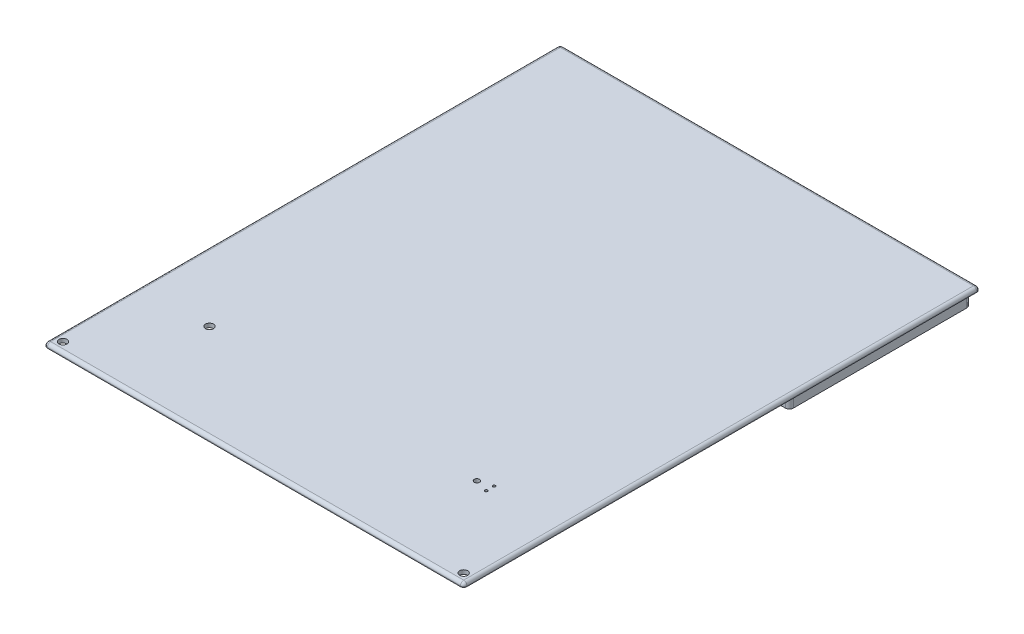
from build123d import *

# Parameters (mm, degrees)
BOSS_EXTRUDE1_DEPTH      = 1.25
SKETCH1_W                = 156
SKETCH1_H                = 69.5
BOSS_EXTRUDE2_DEPTH      = 105
SKETCH4_R                = 2.5000000000000027
BOSS_EXTRUDE3_DEPTH      = 8
FILLET2_R                = 2
SKETCH5_R                = 1.5499999999999998
SKETCH5_R_2              = 1.5500000000000012
CUT_EXTRUDE1_DEPTH       = 8
SKETCH6_R                = 8.25
CUT_EXTRUDE2_DEPTH       = 8
SKETCH8_R                = 3.750000000000007
SKETCH8_R_2              = 3.0000000000000084
SKETCH8_W                = 7.000000000000014
SKETCH8_H                = 14
CUT_EXTRUDE3_DEPTH       = 8
FILLET3_R                = 1.25
FILLET4_R                = 1.25
SKETCH11_R               = 1.5499999999999932
CUT_EXTRUDE4_DEPTH       = 8
BOSS_EXTRUDE5_REACH      = 209.004
FILLET5_R                = 1.25
SKETCH14_R               = 1.5249999999999995
CUT_EXTRUDE5_DEPTH       = 8
BOSS_EXTRUDE6_DEPTH      = 5
CUT_EXTRUDE10_DEPTH      = 176.50000000000017
CUT_EXTRUDE10_DEPTH_BACK = 9
SKETCH19_R               = 1.5249999999999995
BOSS_EXTRUDE7_DEPTH      = 1.5
SKETCH17_W               = 214.39373035957487
SKETCH17_H               = 311.75060194691184
CUT_EXTRUDE6_DEPTH       = 142.50000000000003
SKETCH18_W               = 843.8612520819788
SKETCH18_H               = 210.19069540658822
CUT_EXTRUDE7_DEPTH       = 211.50000000000009
FILLET6_R                = 1.25
SKETCH21_R               = 1.5249999999999995
CUT_EXTRUDE11_DEPTH      = 46.50000000000004
SKETCH22_R               = 1.5249999999999952
SKETCH22_R_2             = 0.49999999999999917
SKETCH22_R_3             = 0.9999999999999983
CUT_EXTRUDE12_DEPTH      = 46.50000000000004


with BuildPart() as part:
    # Sketch2 → Boss-Extrude1 (new body)
    with BuildSketch(Plane(origin=(0, 0, 0), x_dir=(1, 0, 0), z_dir=(0, 1, 0))):
        Polygon((-79.25000000000004, 35.99999999999998), (79.24999999999996, 35.99999999999999), (79.24999999999999, -159.00000000000003), (-79.25000000000001, -159.00000000000003), align=None)
    extrude(amount=-BOSS_EXTRUDE1_DEPTH)

    # Sketch1 → Boss-Extrude2 (add)
    with BuildSketch(Plane(origin=(0, 0, 0), x_dir=(1, 0, 0), z_dir=(0, 1, 0))):
        Polygon((79.24999999999999, -159.00000000000003), (-79.25000000000001, -159.00000000000003), (-79.25000000000004, -86.00000000000001), (-79.25000000000004, -36.00000000000002), (-79.25000000000004, 35.99999999999998), (79.24999999999996, 35.99999999999999), (79.24999999999996, -36.00000000000002), (79.24999999999996, -86.00000000000001), align=None)
        Polygon((-78.00000000000001, -157.75000000000006), (77.99999999999999, -157.75000000000006), (77.99999999999996, -86.00000000000001), (77.99999999999996, -36.00000000000002), (-78.00000000000004, -36.00000000000002), (-78.00000000000004, -86.00000000000001), (-78.00000000000004, -100.58859756900745), align=None, mode=Mode.SUBTRACT)
        Rectangle(SKETCH1_W, SKETCH1_H, mode=Mode.SUBTRACT)
    extrude(amount=BOSS_EXTRUDE2_DEPTH)

    # Sketch4 → Boss-Extrude3 (add)
    with BuildSketch(Plane(origin=(0, 0, 0), x_dir=(1, 0, 0), z_dir=(0, 1, 0))):
        with Locations(Location((-37.074999999999996, -117.75000000000004, 0), (0, 0, 90))):
            Circle(SKETCH4_R)
        with Locations(Location((37.074999999999996, -117.75000000000003, 0), (0, 0, 90))):
            Circle(SKETCH4_R)
    extrude(amount=BOSS_EXTRUDE3_DEPTH)

    # Fillet2
    fillet2_edges = [part.edges().sort_by_distance(p)[0] for p in [
        (77.99999999999996, 52.5, -34.749999999999986),
        (77.99999999999996, 52.5, 34.750000000000014),
        (-78.00000000000004, 0, 1.421e-14),
        (-78.00000000000004, 52.5, 34.750000000000014),
        (77.99999999999999, 52.5, 157.75000000000006),
        (-78.00000000000001, 52.5, 157.75000000000006),
        (-4.263e-14, 0, 36.00000000000002),
        (-78.00000000000004, 52.5, 36.00000000000002),
        (77.99999999999997, 0, 96.87500000000003),
        (77.99999999999996, 52.5, 36.00000000000002),
        (-4.263e-14, 0, -34.749999999999986),
        (-78.00000000000004, 52.5, -34.749999999999986),
        (-1.421e-14, 0, 157.75000000000006),
        (-78.00000000000003, 0, 96.87500000000004),
        (77.99999999999996, 0, 1.421e-14),
        (-4.263e-14, 0, 34.750000000000014),
        (-37.074999999999996, 0, 120.25000000000004),
        (37.074999999999996, 0, 120.25000000000003),
    ]]
    fillet(fillet2_edges, radius=FILLET2_R)

    # Sketch5 → Cut-Extrude1 (cut)
    with BuildSketch(Plane.XY.offset(36.00000000000002)):
        with BuildLine():
            ThreePointArc((-53.750000000000085, 99.54999999999998), (-54.84601551083924, 99.09601551083914), (-55.30000000000008, 97.99999999999999))
            Line((-55.30000000000008, 97.99999999999999), (-53.750000000000085, 97.99999999999999))
            Line((-53.750000000000085, 97.99999999999999), (-53.750000000000085, 99.54999999999998))
        make_face()
        with BuildLine():
            Line((-53.750000000000085, 97.99999999999999), (-55.30000000000008, 97.99999999999999))
            ThreePointArc((-55.30000000000008, 97.99999999999999), (-53.750000000000085, 96.44999999999999), (-52.20000000000009, 97.99999999999999))
            ThreePointArc((-52.20000000000009, 97.99999999999999), (-52.65398448916093, 99.09601551083914), (-53.750000000000085, 99.54999999999998))
            Line((-53.750000000000085, 99.54999999999998), (-53.750000000000085, 97.99999999999999))
        make_face()
        with Locations((53.750000000000206, 97.99999999999967)):
            Circle(SKETCH5_R)
        with Locations((-53.750000000000085, 7.999999999999743)):
            Circle(SKETCH5_R_2)
        with Locations((53.749999999999666, 7.9999999999994245)):
            Circle(SKETCH5_R_2)
    extrude(amount=-CUT_EXTRUDE1_DEPTH, mode=Mode.SUBTRACT)

    # Sketch6 → Cut-Extrude2 (cut)
    with BuildSketch(Plane(origin=(0, 0, 157.75000000000006), x_dir=(-1, 0, 0), z_dir=(0, 0, -1))):
        with Locations((0, 22)):
            Circle(SKETCH6_R)
    extrude(amount=-CUT_EXTRUDE2_DEPTH, mode=Mode.SUBTRACT)

    # Sketch8 → Cut-Extrude3 (cut)
    with BuildSketch(Plane.ZY.offset(79.25000000000004)):
        with Locations((131.5, 54.99999999999998)):
            Circle(SKETCH8_R)
        with Locations((101.50000000000001, 54.99999999999998)):
            Circle(SKETCH8_R_2)
        with Locations((116.50000000000003, 64.99999999999999)):
            Rectangle(SKETCH8_W, SKETCH8_H)
        with Locations((101.50000000000001, 64.99999999999997)):
            Circle(SKETCH8_R_2)
        with Locations((101.50000000000001, 74.99999999999997)):
            Circle(SKETCH8_R_2)
        with Locations((101.50000000000001, 84.99999999999997)):
            Circle(SKETCH8_R_2)
        with Locations((131.5, 74.99999999999999)):
            Circle(SKETCH8_R)
    extrude(amount=-CUT_EXTRUDE3_DEPTH, mode=Mode.SUBTRACT)

    # Fillet3
    fillet3_edges = [part.edges().sort_by_distance(p)[0] for p in [
        (79.24999999999997, -1.25, 61.50000000000002),
        (-4.263e-14, -1.25, -35.999999999999986),
        (-79.25000000000003, -1.25, 61.50000000000003),
        (-1.421e-14, -1.25, 159.00000000000003),
    ]]
    fillet(fillet3_edges, radius=FILLET3_R)

    # Fillet4
    # the kernel refuses this fillet: 1.25 mm, written as the material it takes off along each edge
    with BuildSketch(Plane(origin=(-78.00000000000004, 0, -34.74999999999997), x_dir=(-9e-17, 0, -1), z_dir=(-1, 0, 1.5e-16))) as fillet4_piece_1_section:
        Polygon((0, 0), (FILLET4_R, 0), (FILLET4_R, FILLET4_R), (0, FILLET4_R), align=None)
    fillet4_piece_1 = extrude(amount=FILLET4_R, mode=Mode.PRIVATE)
    fillet4_piece_1 = fillet4_piece_1 - Plane(origin=(-78.00000000000004, 0, -34.74999999999997), x_dir=(0, 0.7071067811865475, 0.7071067811865475), z_dir=(-1, 0, 1.5e-16)) * Sphere(FILLET4_R, mode=Mode.PRIVATE)
    add(fillet4_piece_1, mode=Mode.SUBTRACT)
    with BuildSketch(Plane(origin=(77.99999999999996, 0, -34.74999999999999), x_dir=(-9e-17, 0, -1), z_dir=(1, 0, -1.5e-16))) as fillet4_piece_2_section:
        Polygon((0, 0), (FILLET4_R, 0), (FILLET4_R, -FILLET4_R), (0, -FILLET4_R), align=None)
    fillet4_piece_2 = extrude(amount=FILLET4_R, mode=Mode.PRIVATE)
    fillet4_piece_2 = fillet4_piece_2 - Plane(origin=(77.99999999999996, 0, -34.74999999999999), x_dir=(0, 0.7071067811865475, 0.7071067811865475), z_dir=(1, 0, -1.5e-16)) * Sphere(FILLET4_R, mode=Mode.PRIVATE)
    add(fillet4_piece_2, mode=Mode.SUBTRACT)
    with BuildSketch(Plane(origin=(-78.00000000000001, 0, 157.75000000000003), x_dir=(-1, 0, 1.5e-16), z_dir=(0, 0, 1))) as fillet4_piece_3_section:
        Polygon((0, 0), (FILLET4_R, 0), (FILLET4_R, FILLET4_R), (0, FILLET4_R), align=None)
    fillet4_piece_3 = extrude(amount=FILLET4_R, mode=Mode.PRIVATE)
    fillet4_piece_3 = fillet4_piece_3 - Plane(origin=(-78.00000000000001, 0, 157.75000000000003), x_dir=(0.7071067811865475, 0.7071067811865475, 0), z_dir=(0, 0, 1)) * Sphere(FILLET4_R, mode=Mode.PRIVATE)
    add(fillet4_piece_3, mode=Mode.SUBTRACT)
    with BuildSketch(Plane(origin=(77.99999999999999, 0, 157.75000000000003), x_dir=(1, 0, -1.5e-16), z_dir=(0, 0, 1))) as fillet4_piece_4_section:
        Polygon((0, 0), (FILLET4_R, 0), (FILLET4_R, -FILLET4_R), (0, -FILLET4_R), align=None)
    fillet4_piece_4 = extrude(amount=FILLET4_R, mode=Mode.PRIVATE)
    fillet4_piece_4 = fillet4_piece_4 - Plane(origin=(77.99999999999999, 0, 157.75000000000003), x_dir=(-0.7071067811865475, 0.7071067811865475, 0), z_dir=(0, 0, 1)) * Sphere(FILLET4_R, mode=Mode.PRIVATE)
    add(fillet4_piece_4, mode=Mode.SUBTRACT)
    with BuildSketch(Plane(origin=(79.24999999999999, 108.12500000000007, 159.00000000000003), x_dir=(-1, 0, 0), z_dir=(0, -1, 0))) as fillet4_piece_5:
        with BuildLine():
            CenterArc((FILLET4_R, FILLET4_R), FILLET4_R, 179.9999999999987, 90.00000000000131)
            Line((0, FILLET4_R), (0, 0))
            Line((0, 0), (FILLET4_R, 0))
        make_face()
    extrude(amount=108.12500000000007, mode=Mode.SUBTRACT)
    with BuildSketch(Plane(origin=(-79.25000000000001, -2.2e-16, 159.00000000000003), x_dir=(1, 0, 0), z_dir=(0, 1, 0))) as fillet4_piece_6:
        with BuildLine():
            CenterArc((FILLET4_R, FILLET4_R), FILLET4_R, 180, 90)
            Line((0, FILLET4_R), (0, 0))
            Line((0, 0), (FILLET4_R, 0))
        make_face()
    extrude(amount=108.12499999999999, mode=Mode.SUBTRACT)
    with BuildSketch(Plane(origin=(79.24999999999996, 108.125, -35.99999999999999), x_dir=(0, 0, 1), z_dir=(0, -1, 0))) as fillet4_piece_7:
        with BuildLine():
            CenterArc((FILLET4_R, FILLET4_R), FILLET4_R, 180, 90)
            Line((0, FILLET4_R), (0, 0))
            Line((0, 0), (FILLET4_R, 0))
        make_face()
    extrude(amount=108.125, mode=Mode.SUBTRACT)
    with BuildSketch(Plane(origin=(-79.25000000000004, -2.2e-16, -35.99999999999998), x_dir=(0, 0, 1), z_dir=(0, 1, 0))) as fillet4_piece_8:
        with BuildLine():
            CenterArc((FILLET4_R, FILLET4_R), FILLET4_R, 180, 90)
            Line((-2.132e-14, FILLET4_R), (0, 0))
            Line((0, 0), (FILLET4_R, 0))
        make_face()
    extrude(amount=108.12499999999999, mode=Mode.SUBTRACT)

    # Sketch11 → Cut-Extrude4 (cut)
    with BuildSketch(Plane(origin=(79.24999999999996, 0, -1.128e-14), x_dir=(-1.4e-16, 0, -1), z_dir=(1, 0, -1.4e-16))):
        with BuildLine():
            ThreePointArc((-13.05000000000001, 102.49999999999999), (-12.596015510839159, 101.40398448916083), (-11.50000000000001, 100.94999999999999))
            Line((-11.50000000000001, 100.94999999999999), (-11.50000000000001, 102.49999999999999))
            Line((-11.500000000000014, 102.49999999999999), (-13.050000000000011, 102.49999999999999))
        make_face()
        with BuildLine():
            Line((-11.50000000000001, 102.49999999999999), (-11.50000000000001, 100.94999999999999))
            ThreePointArc((-11.50000000000001, 100.94999999999999), (-10.403984489160864, 101.40398448916083), (-9.950000000000012, 102.49999999999999))
            ThreePointArc((-9.950000000000012, 102.49999999999999), (-11.50000000000001, 104.04999999999998), (-13.05000000000001, 102.49999999999999))
            Line((-13.050000000000011, 102.49999999999999), (-11.500000000000014, 102.49999999999999))
        make_face()
        with BuildLine():
            ThreePointArc((-25.550000000000008, 90), (-25.096015510839155, 88.90398448916085), (-24.000000000000007, 88.45))
            Line((-24.000000000000007, 88.45000000000002), (-24.000000000000007, 90))
            Line((-24, 90), (-25.55000000000001, 90))
        make_face()
        with BuildLine():
            Line((-24.000000000000007, 90), (-24.000000000000007, 88.45000000000002))
            ThreePointArc((-24.000000000000007, 88.45), (-22.90398448916086, 88.90398448916085), (-22.450000000000006, 90))
            ThreePointArc((-22.450000000000006, 90), (-24.000000000000007, 91.55), (-25.550000000000008, 90))
            Line((-25.55000000000001, 90), (-24, 90))
        make_face()
        with BuildLine():
            ThreePointArc((-9.949999999999998, 2.4999999999999742), (-10.403984489160848, 3.5960155108391216), (-11.499999999999995, 4.049999999999974))
            Line((-11.499999999999996, 4.049999999999969), (-11.499999999999996, 2.4999999999999716))
            Line((-11.5, 2.4999999999999742), (-13.049999999999997, 2.4999999999999742))
            ThreePointArc((-13.049999999999995, 2.4999999999999742), (-11.499999999999996, 0.9499999999999749), (-9.949999999999998, 2.499999999999974))
        make_face()
        with BuildLine():
            Line((-11.499999999999996, 2.4999999999999716), (-11.499999999999996, 4.049999999999969))
            ThreePointArc((-11.499999999999995, 4.049999999999974), (-12.596015510839145, 3.596015510839123), (-13.049999999999995, 2.4999999999999742))
            Line((-13.049999999999997, 2.4999999999999742), (-11.5, 2.4999999999999742))
        make_face()
        with BuildLine():
            ThreePointArc((-111.5, 4.049999999999969), (-112.59601551083915, 1.40398448916083), (-109.95, 2.499999999999974))
            Line((-109.95, 2.4999999999999742), (-111.5, 2.4999999999999742))
            Line((-111.5, 2.4999999999999716), (-111.5, 4.049999999999969))
        make_face()
        with BuildLine():
            Line((-111.5, 2.4999999999999742), (-109.95, 2.4999999999999742))
            ThreePointArc((-109.95, 2.4999999999999742), (-110.40398448916086, 3.5960155108391185), (-111.5, 4.049999999999969))
            Line((-111.5, 4.049999999999969), (-111.5, 2.4999999999999716))
        make_face()
        with BuildLine():
            ThreePointArc((-97.45, 14.999999999999993), (-97.90398448916086, 16.096015510839138), (-99, 16.549999999999986))
            Line((-99, 16.549999999999986), (-99, 14.999999999999993))
            Line((-99, 14.999999999999993), (-97.45, 14.999999999999993))
        make_face()
        with BuildLine():
            Line((-99, 14.999999999999993), (-99, 16.549999999999986))
            ThreePointArc((-99, 16.549999999999986), (-100.09601551083915, 13.903984489160848), (-97.45, 14.999999999999993))
            Line((-97.45, 14.999999999999993), (-99, 14.999999999999993))
        make_face()
        with BuildLine():
            ThreePointArc((-22.450000000000006, 14.999999999999993), (-22.90398448916086, 16.09601551083914), (-24.000000000000007, 16.549999999999994))
            Line((-24.000000000000007, 16.549999999999994), (-24.000000000000007, 14.999999999999993))
            Line((-24, 14.999999999999993), (-25.55000000000001, 14.999999999999993))
            ThreePointArc((-25.550000000000008, 14.999999999999993), (-24.000000000000007, 13.449999999999992), (-22.450000000000006, 14.999999999999993))
        make_face()
        with BuildLine():
            Line((-24.000000000000007, 14.999999999999993), (-24.000000000000007, 16.549999999999994))
            ThreePointArc((-24.000000000000007, 16.549999999999994), (-25.096015510839155, 16.09601551083914), (-25.550000000000008, 14.999999999999993))
            Line((-25.55000000000001, 14.999999999999993), (-24, 14.999999999999993))
        make_face()
        with Locations((-111.50000000000001, 102.49999999999999)):
            Circle(SKETCH11_R)
        with Locations((-99, 90)):
            Circle(SKETCH11_R)
    extrude(amount=-CUT_EXTRUDE4_DEPTH, mode=Mode.SUBTRACT)

    # Boss-Extrude5: up to this face of the body (flat: up to its plane)
    boss_extrude5_end = Plane(part.part.faces().sort_by_distance((0, 0, 96.725539908))[0])
    # Sketch12 → Boss-Extrude5 (add, up to the picked face)
    with BuildSketch(Plane(origin=(0, 105, 0), x_dir=(1, 0, 0), z_dir=(0, 1, 0)), mode=Mode.PRIVATE) as boss_extrude5_sk1:
        with BuildLine():
            Line((73, -152.75000000000043), (72.99999999999997, -157.75000000000043))
            Line((72.99999999999997, -157.75000000000043), (75.99999999999996, -157.75000000000045))
            ThreePointArc((75.99999999999996, -157.75000000000006), (77.41421356237305, -157.16421356237316), (77.99999999999994, -155.75000000000006))
            Line((77.99999999999999, -155.75000000000006), (78, -152.75000000000045))
            Line((78, -152.75000000000045), (73, -152.75000000000043))
        make_face()
    boss_extrude5_tool1 = split(extrude(boss_extrude5_sk1.sketch, amount=-BOSS_EXTRUDE5_REACH, mode=Mode.PRIVATE), bisect_by=boss_extrude5_end, keep=Keep.BOTH, mode=Mode.PRIVATE)
    # Sketch12 → Boss-Extrude5 (add, up to the picked face)
    with BuildSketch(Plane(origin=(0, 105, 0), x_dir=(1, 0, 0), z_dir=(0, 1, 0)), mode=Mode.PRIVATE) as boss_extrude5_sk2:
        with BuildLine():
            ThreePointArc((-78.00000000000003, -155.75000000000006), (-77.41421356237313, -157.16421356237316), (-76.00000000000003, -157.75000000000006))
            Line((-76.00000000000003, -157.75000000000006), (-73.00000000000003, -157.75000000000006))
            Line((-73.00000000000003, -157.75000000000006), (-73.00000000000003, -152.75000000000006))
            Line((-73.00000000000003, -152.75000000000006), (-78.00000000000003, -152.75000000000006))
            Line((-78.00000000000003, -152.75000000000006), (-78.00000000000003, -155.75000000000006))
        make_face()
    boss_extrude5_tool2 = split(extrude(boss_extrude5_sk2.sketch, amount=-BOSS_EXTRUDE5_REACH, mode=Mode.PRIVATE), bisect_by=boss_extrude5_end, keep=Keep.BOTH, mode=Mode.PRIVATE)
    add(boss_extrude5_tool1.solids().sort_by(Axis((75.426992, 105, 155.176992), (0, -1, 0)))[0])
    add(boss_extrude5_tool2.solids().sort_by(Axis((-75.426992, 105, 155.176992), (0, -1, 0)))[0])

    # Fillet5
    fillet5_edges = [part.edges().sort_by_distance(p)[0] for p in [
        (77.41421356237306, 0.5857864376269042, 152.75000000000043),
        (72.99999999999999, 0.5857864376269046, 157.16421356237316),
        (72.99999999999997, 53.5, 157.75000000000043),
        (74.49999999999999, 0, 152.75000000000043),
        (73, 52.5, 152.75000000000043),
        (78, 53.5, 152.75000000000045),
        (73, 0, 154.25000000000023),
        (-77.41421356237313, 0.5857864376269042, 152.75000000000006),
        (-73.00000000000003, 0, 154.25000000000006),
        (-73.00000000000003, 52.5, 152.75000000000006),
        (-78.00000000000003, 53.5, 152.75000000000006),
        (-74.50000000000003, 0, 152.75000000000006),
        (-73.00000000000003, 0.5857864376269046, 157.16421356237316),
        (-73.00000000000003, 53.5, 157.75000000000006),
    ]]
    fillet(fillet5_edges, radius=FILLET5_R)

    # Sketch14 → Cut-Extrude5 (cut)
    with BuildSketch(Plane(origin=(0, 105, 0), x_dir=(1, 0, 0), z_dir=(0, 1, 0))):
        with Locations(Location((75.68305826175839, -155.43305826175865, 0), (0, 0, 270))):
            Circle(SKETCH14_R)
        with Locations(Location((-75.68305826175845, -155.43305826175828, 0), (0, 0, 270))):
            Circle(SKETCH14_R)
    extrude(amount=-CUT_EXTRUDE5_DEPTH, mode=Mode.SUBTRACT)

    # Sketch19 → Cut-Extrude10 (cut, two sides: drawn at the far end of the back side and taken through both)
    with BuildSketch(Plane(origin=(0, 105, 0), x_dir=(1, 0, 0), z_dir=(0, 1, 0)).offset(-CUT_EXTRUDE10_DEPTH_BACK)):
        with Locations(Location((75.68305826175839, -155.43305826175865, 0), (0, 0, 270))):
            Circle(SKETCH19_R)
        with Locations(Location((-75.68305826175845, -155.43305826175828, 0), (0, 0, 270))):
            Circle(SKETCH19_R)
    extrude(amount=CUT_EXTRUDE10_DEPTH + CUT_EXTRUDE10_DEPTH_BACK, mode=Mode.SUBTRACT)



with BuildPart() as body_2:
    # Sketch15 → Boss-Extrude6 (new body)
    with BuildSketch(Plane(origin=(0, 105, 0), x_dir=(1, 0, 0), z_dir=(0, 1, 0))):
        with BuildLine():
            Line((-77.50000000000004, 32.749999999999986), (-77.50000000000004, -32.750000000000014))
            ThreePointArc((-77.50000000000004, -32.750000000000014), (-77.06066017177986, -33.81066017177984), (-76.00000000000004, -34.250000000000014))
            Line((-76.00000000000004, -34.250000000000014), (75.99999999999996, -34.250000000000014))
            ThreePointArc((75.99999999999996, -34.250000000000014), (77.06066017177977, -33.81066017177984), (77.49999999999996, -32.750000000000014))
            Line((77.49999999999996, -32.750000000000014), (77.49999999999996, 32.749999999999986))
            ThreePointArc((77.49999999999996, 32.749999999999986), (77.06066017177977, 33.81066017177981), (75.99999999999996, 34.249999999999986))
            Line((75.99999999999996, 34.249999999999986), (-76.00000000000004, 34.249999999999986))
            ThreePointArc((-76.00000000000004, 34.249999999999986), (-77.06066017177986, 33.81066017177981), (-77.50000000000004, 32.749999999999986))
        make_face()
        with BuildLine():
            Line((75.99999999999996, 32.999999999999986), (-76.00000000000004, 32.999999999999986))
            ThreePointArc((-76.00000000000004, 32.999999999999986), (-76.17677669529668, 32.926776695296624), (-76.25000000000004, 32.749999999999986))
            Line((-76.25000000000004, 32.749999999999986), (-76.25000000000004, -32.750000000000014))
            ThreePointArc((-76.25000000000004, -32.750000000000014), (-76.17677669529668, -32.92677669529665), (-76.00000000000004, -33.000000000000014))
            Line((-76.00000000000004, -33.000000000000014), (75.99999999999996, -33.000000000000014))
            ThreePointArc((75.99999999999996, -33.000000000000014), (76.1767766952966, -32.92677669529665), (76.24999999999996, -32.750000000000014))
            Line((76.24999999999996, -32.750000000000014), (76.24999999999996, 32.749999999999986))
            ThreePointArc((76.24999999999996, 32.749999999999986), (76.1767766952966, 32.926776695296624), (75.99999999999996, 32.999999999999986))
        make_face(mode=Mode.SUBTRACT)
    extrude(amount=-BOSS_EXTRUDE6_DEPTH)


with BuildPart() as part_1:
    add(part.part)

    add(body_2.part)  # Boss-Extrude7 merges body 2
    # Sketch16 → Boss-Extrude7 (add)
    with BuildSketch(Plane(origin=(0, 105, 0), x_dir=(1, 0, 0), z_dir=(0, 1, 0))):
        with BuildLine():
            Line((-79.25000000000004, 34.74999999999998), (-79.25000000000004, -157.75000000000003))
            ThreePointArc((-79.25000000000004, -157.75000000000003), (-78.88388347648322, -158.63388347648322), (-78.00000000000001, -159.00000000000003))
            Line((-78.00000000000001, -159.00000000000003), (77.99999999999999, -159.00000000000003))
            ThreePointArc((77.99999999999999, -159.00000000000003), (78.88388347648316, -158.63388347648322), (79.24999999999999, -157.75000000000003))
            Line((79.24999999999999, -157.75000000000003), (79.24999999999991, 34.749999999999986))
            ThreePointArc((79.24999999999991, 34.749999999999986), (78.8838834764831, 35.63388347648314), (77.99999999999996, 35.99999999999997))
            Line((77.99999999999996, 35.99999999999997), (-78.00000000000004, 35.99999999999998))
            ThreePointArc((-78.00000000000004, 35.99999999999998), (-78.88388347648322, 35.63388347648316), (-79.25000000000004, 34.74999999999998))
        make_face()
    extrude(amount=BOSS_EXTRUDE7_DEPTH)

    # Sketch17 → Cut-Extrude6 (cut)
    with BuildSketch(Plane.XZ.offset(-105)):
        with Locations((-9.695908791144348, 54.3605461890202)):
            Rectangle(SKETCH17_W, SKETCH17_H)
        with BuildLine():
            Line((77.99999999999996, -32.749999999999986), (77.99999999999996, 32.750000000000014))
            ThreePointArc((77.99999999999996, 32.750000000000014), (77.41421356237305, 34.16421356237311), (75.99999999999996, 34.750000000000014))
            Line((75.99999999999996, 34.750000000000014), (-76.00000000000004, 34.750000000000014))
            ThreePointArc((-76.00000000000004, 34.750000000000014), (-77.41421356237313, 34.16421356237311), (-78.00000000000004, 32.750000000000014))
            Line((-78.00000000000004, 32.750000000000014), (-78.00000000000004, -32.749999999999986))
            ThreePointArc((-78.00000000000004, -32.749999999999986), (-77.41421356237313, -34.16421356237308), (-76.00000000000004, -34.749999999999986))
            Line((-76.00000000000004, -34.749999999999986), (75.99999999999996, -34.749999999999986))
            ThreePointArc((75.99999999999996, -34.749999999999986), (77.41421356237305, -34.16421356237308), (77.99999999999996, -32.749999999999986))
        make_face(mode=Mode.SUBTRACT)
    extrude(amount=CUT_EXTRUDE6_DEPTH, mode=Mode.SUBTRACT)


with BuildPart() as cut_extrude6_piece_1:
    # of the separate pieces the step leaves, piece 1, a body of its own (cut_extrude6_pieces)
    add(part_1.part.solids().sort_by_distance((-76, 105, -34.25))[0])

    # Fillet6
    fillet6_edges = [cut_extrude6_piece_1.edges().sort_by_distance(p)[0] for p in [
        (-78.88388347648322, 106.5, -35.633883476483156),
        (-79.25000000000004, 106.5, 61.50000000000002),
        (-78.88388347648322, 106.5, 158.63388347648322),
        (-1.421e-14, 106.5, 159.00000000000003),
        (78.88388347648318, 106.5, 158.63388347648322),
        (79.24999999999994, 106.5, 61.50000000000003),
        (78.8838834764831, 106.5, -35.63388347648314),
        (-4.263e-14, 106.5, -35.99999999999997),
    ]]
    fillet(fillet6_edges, radius=FILLET6_R)

    # Sketch21 → Cut-Extrude11 (cut)
    with BuildSketch(Plane(origin=(0, 106.5, 0), x_dir=(1, 0, 0), z_dir=(0, 1, 0))):
        with Locations(Location((-75.68068975770814, -155.43068975770817, 0), (0, 0, 270))):
            Circle(SKETCH21_R)
        with Locations(Location((75.68068975770811, -155.43068975770834, 0), (0, 0, 270))):
            Circle(SKETCH21_R)
    extrude(amount=-CUT_EXTRUDE11_DEPTH, mode=Mode.SUBTRACT)

    # Sketch22 → Cut-Extrude12 (cut)
    with BuildSketch(Plane(origin=(0, 106.5, 0), x_dir=(1, 0, 0), z_dir=(0, 1, 0))):
        with Locations(Location((-53.000000000000014, -122.75000000000003, 0), (0, 0, 270))):
            Circle(SKETCH22_R)
        with Locations(Location((53.000000000000014, -121.25000000000003, 0), (0, 0, 270))):
            Circle(SKETCH22_R_2)
        with Locations(Location((53.000000000000014, -124.25000000000003, 0), (0, 0, 270))):
            Circle(SKETCH22_R_2)
        with Locations(Location((48.000000000000014, -122.75000000000003, 0), (0, 0, 270))):
            Circle(SKETCH22_R_3)
    extrude(amount=-CUT_EXTRUDE12_DEPTH, mode=Mode.SUBTRACT)


with BuildPart() as cut_extrude6_piece_2:
    # of the separate pieces the step leaves, piece 2, a body of its own (cut_extrude6_pieces)
    add(part_1.part.solids().sort_by_distance((-78, 2, -32.75))[0])

    # Sketch18 → Cut-Extrude7 (cut)
    with BuildSketch(Plane.XZ.offset(-99.99999999999999)):
        Rectangle(SKETCH18_W, SKETCH18_H)
    extrude(amount=CUT_EXTRUDE7_DEPTH, mode=Mode.SUBTRACT)


solid = cut_extrude6_piece_1.part
